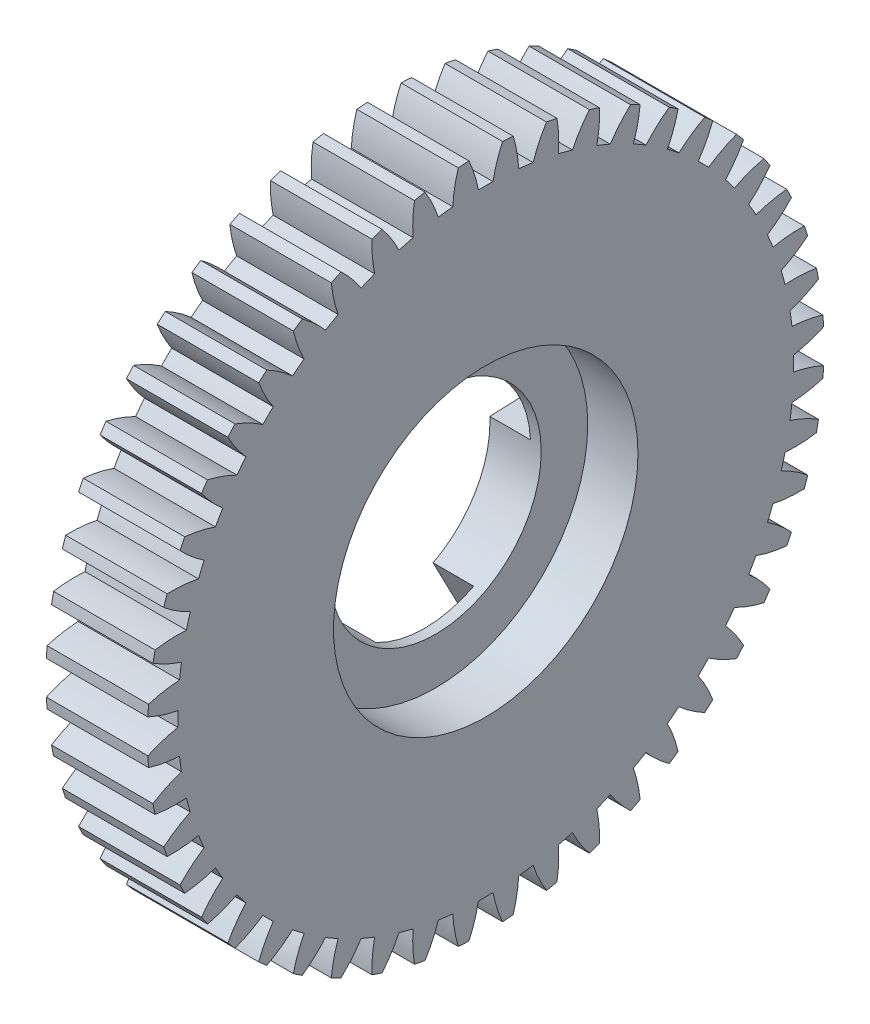
from build123d import *

# Parameters (mm, degrees)
SPUR_START             = -42.202133653
SPUR_GEAR_AI_OUTLINE_R = 9.525
SPUR_GEAR_AI_DEPTH     = 9.525
SKETCH1_R              = 9.921875
CUT_EXTRUDE1_DEPTH     = 64.52518683
SKETCH2_R              = 14.2875
CUT_EXTRUDE2_DEPTH     = 4.71424
CUT_EXTRUDE3_START     = -3.81
SKETCH3_R              = 26.9875
CUT_EXTRUDE3_DEPTH     = 3.81
FILLET3_R              = 3.175


# Read off the part's stored shape, not the designer's step: spur gear_ai
with BuildPart() as part:
    # spur gear_ai outline → spur gear_ai (new body)
    with BuildSketch(Plane.YZ.offset(SPUR_START)):
        with BuildLine():
            ThreePointArc((39.801048248, 9.63014284), (39.902920448, 10.121928447), (39.997001011, 10.615263906))
            ThreePointArc((39.997001011, 10.615263906), (38.698236885, 11.321633429), (37.323523356, 11.865608495))
            ThreePointArc((37.323523356, 11.865608495), (37.420899802, 12.54316048), (37.502204736, 13.222828319))
            ThreePointArc((37.502204736, 13.222828319), (38.970867144, 13.392465841), (40.408198841, 13.738621515))
            ThreePointArc((40.408198841, 13.738621515), (40.445008608, 14.239496818), (40.4738911, 14.740891702))
            ThreePointArc((40.4738911, 14.740891702), (39.094038357, 15.271695399), (37.660082699, 15.631580561))
            ThreePointArc((37.660082699, 15.631580561), (37.668187795, 16.316046171), (37.660082699, 17.000511781))
            ThreePointArc((37.660082699, 17.000511781), (39.094038357, 17.360396942), (40.4738911, 17.89120064))
            ThreePointArc((40.4738911, 17.89120064), (40.445008608, 18.392595524), (40.408198841, 18.893470827))
            ThreePointArc((40.408198841, 18.893470827), (38.970867144, 19.239626501), (37.502204736, 19.409264023))
            ThreePointArc((37.502204736, 19.409264023), (37.420899802, 20.088931862), (37.323523356, 20.766483847))
            ThreePointArc((37.323523356, 20.766483847), (38.698236885, 21.310458913), (39.997001011, 22.016828435))
            ThreePointArc((39.997001011, 22.016828435), (39.902920448, 22.510163894), (39.801048248, 23.001949501))
            ThreePointArc((39.801048248, 23.001949501), (38.330830741, 23.157534332), (36.852590803, 23.13402167))
            ThreePointArc((36.852590803, 23.13402167), (36.683266989, 23.797262433), (36.498285332, 24.45630769))
            ThreePointArc((36.498285332, 24.45630769), (37.790235002, 25.175065096), (38.985688297, 26.044914266))
            ThreePointArc((38.985688297, 26.044914266), (38.828019407, 26.521749194), (38.662827835, 26.996030516))
            ThreePointArc((38.662827835, 26.996030516), (37.184880347, 26.958382404), (35.722355975, 26.742121866))
            ThreePointArc((35.722355975, 26.742121866), (35.467910459, 27.37758732), (35.198488677, 28.006849402))
            ThreePointArc((35.198488677, 28.006849402), (36.385568871, 28.88809101), (37.457256797, 29.906536465))
            ThreePointArc((37.457256797, 29.906536465), (37.238697339, 30.358712085), (37.013012869, 30.807374038))
            ThreePointArc((37.013012869, 30.807374038), (35.552623491, 30.577137153), (34.130838883, 30.171829016))
            ThreePointArc((34.130838883, 30.171829016), (33.795625297, 30.768646171), (33.446373272, 31.357358229))
            ThreePointArc((33.446373272, 31.357358229), (34.508272719, 32.38600575), (35.4378584, 33.535621608))
            ThreePointArc((35.4378584, 33.535621608), (35.162147986, 33.955401069), (34.879832141, 34.370766922))
            ThreePointArc((34.879832141, 34.370766922), (33.461988541, 33.951880681), (32.105270825, 33.364459881))
            ThreePointArc((32.105270825, 33.364459881), (31.695024767, 33.912417029), (31.271918299, 34.450506037))
            ThreePointArc((31.271918299, 34.450506037), (32.190467605, 35.608959027), (32.96204557, 36.870075041))
            ThreePointArc((32.96204557, 36.870075041), (32.633901683, 37.2502758), (32.299784966, 37.625238529))
            ThreePointArc((32.299784966, 37.625238529), (30.94874684, 37.024870191), (29.680309833, 36.265387659))
            ThreePointArc((29.680309833, 36.265387659), (29.202050727, 36.755109102), (28.712329284, 37.233368208))
            ThreePointArc((28.712329284, 37.233368208), (29.471811815, 38.501805216), (30.072180153, 39.852843342))
            ThreePointArc((30.072180153, 39.852843342), (29.697217425, 40.186960058), (29.317016666, 40.515103946))
            ThreePointArc((29.317016666, 40.515103946), (28.055900652, 39.74352598), (26.897447661, 38.824976674))
            ThreePointArc((26.897447661, 38.824976674), (26.359358653, 39.248083143), (25.811401505, 39.6583292))
            ThreePointArc((25.811401505, 39.6583292), (26.398822306, 41.015046916), (26.817708547, 42.432890517))
            ThreePointArc((26.817708547, 42.432890517), (26.402342694, 42.715206362), (25.982563233, 42.990916775))
            ThreePointArc((25.982563233, 42.990916775), (24.832947375, 42.061331095), (23.804299854, 40.999431648))
            ThreePointArc((23.804299854, 40.999431648), (23.215587795, 41.348683672), (22.618770641, 41.683897258))
            ThreePointArc((22.618770641, 41.683897258), (23.024078778, 43.105681866), (23.254315663, 44.566071244))
            ThreePointArc((23.254315663, 44.566071244), (22.80565371, 44.791755715), (22.35347809, 45.010315173))
            ThreePointArc((22.35347809, 45.010315173), (21.335032634, 43.938627246), (20.453791026, 42.751547052))
            ThreePointArc((20.453791026, 42.751547052), (19.824528945, 43.020968834), (19.189063491, 43.27541435))
            ThreePointArc((19.189063491, 43.27541435), (19.405324029, 44.737938722), (19.442972141, 46.21588621))
            ThreePointArc((19.442972141, 46.21588621), (18.968690819, 46.381077782), (18.49185589, 46.538746672))
            ThreePointArc((18.49185589, 46.538746672), (17.622006721, 45.343293377), (16.903249315, 44.051343707))
            ThreePointArc((16.903249315, 44.051343707), (16.244204058, 44.236325365), (15.580963295, 44.405649179))
            ThreePointArc((15.580963295, 44.405649179), (15.604475957, 45.883889116), (15.448891126, 47.354106623))
            ThreePointArc((15.448891126, 47.354106623), (14.95710552, 47.455978824), (14.46377006, 47.550059387))
            ThreePointArc((14.46377006, 47.550059387), (13.757400537, 46.251295261), (13.213425471, 44.876581732))
            ThreePointArc((13.213425471, 44.876581732), (12.535873486, 44.973958178), (11.856205647, 45.055263112))
            ThreePointArc((11.856205647, 45.055263112), (11.686568125, 46.52392552), (11.340412451, 47.961257217))
            ThreePointArc((11.340412451, 47.961257217), (10.839537148, 47.998066984), (10.338142264, 48.026949476))
            ThreePointArc((10.338142264, 48.026949476), (9.807338567, 46.647096733), (9.447453406, 45.213141075))
            ThreePointArc((9.447453406, 45.213141075), (8.762987795, 45.221246171), (8.078522185, 45.213141075))
            ThreePointArc((8.078522185, 45.213141075), (7.718637024, 46.647096733), (7.187833326, 48.026949476))
            ThreePointArc((7.187833326, 48.026949476), (6.686438442, 47.998066984), (6.185563139, 47.961257217))
            ThreePointArc((6.185563139, 47.961257217), (5.839407465, 46.52392552), (5.669769943, 45.055263112))
            ThreePointArc((5.669769943, 45.055263112), (4.990102104, 44.973958178), (4.312550119, 44.876581732))
            ThreePointArc((4.312550119, 44.876581732), (3.768575054, 46.251295261), (3.062205531, 47.550059387))
            ThreePointArc((3.062205531, 47.550059387), (2.568870071, 47.455978824), (2.077084465, 47.354106623))
            ThreePointArc((2.077084465, 47.354106623), (1.921499634, 45.883889116), (1.945012296, 44.405649179))
            ThreePointArc((1.945012296, 44.405649179), (1.281771533, 44.236325365), (0.622726276, 44.051343707))
            ThreePointArc((0.622726276, 44.051343707), (-0.09603113, 45.343293377), (-0.965880299, 46.538746672))
            ThreePointArc((-0.965880299, 46.538746672), (-1.442715228, 46.381077782), (-1.91699655, 46.21588621))
            ThreePointArc((-1.91699655, 46.21588621), (-1.879348438, 44.737938722), (-1.6630879, 43.27541435))
            ThreePointArc((-1.6630879, 43.27541435), (-2.298553354, 43.020968834), (-2.927815436, 42.751547052))
            ThreePointArc((-2.927815436, 42.751547052), (-3.809057043, 43.938627246), (-4.827502499, 45.010315173))
            ThreePointArc((-4.827502499, 45.010315173), (-5.279678119, 44.791755715), (-5.728340072, 44.566071244))
            ThreePointArc((-5.728340072, 44.566071244), (-5.498103187, 43.105681866), (-5.09279505, 41.683897258))
            ThreePointArc((-5.09279505, 41.683897258), (-5.689612205, 41.348683672), (-6.278324263, 40.999431648))
            ThreePointArc((-6.278324263, 40.999431648), (-7.306971784, 42.061331095), (-8.456587642, 42.990916775))
            ThreePointArc((-8.456587642, 42.990916775), (-8.876367103, 42.715206362), (-9.291732956, 42.432890517))
            ThreePointArc((-9.291732956, 42.432890517), (-8.872846715, 41.015046916), (-8.285425914, 39.6583292))
            ThreePointArc((-8.285425914, 39.6583292), (-8.833383062, 39.248083143), (-9.37147207, 38.824976674))
            ThreePointArc((-9.37147207, 38.824976674), (-10.529925061, 39.74352598), (-11.791041075, 40.515103946))
            ThreePointArc((-11.791041075, 40.515103946), (-12.171241834, 40.186960058), (-12.546204562, 39.852843342))
            ThreePointArc((-12.546204562, 39.852843342), (-11.945836225, 38.501805216), (-11.186353693, 37.233368208))
            ThreePointArc((-11.186353693, 37.233368208), (-11.676075136, 36.755109102), (-12.154334242, 36.265387659))
            ThreePointArc((-12.154334242, 36.265387659), (-13.42277125, 37.024870191), (-14.773809375, 37.625238529))
            ThreePointArc((-14.773809375, 37.625238529), (-15.107926092, 37.2502758), (-15.43606998, 36.870075041))
            ThreePointArc((-15.43606998, 36.870075041), (-14.664492014, 35.608959027), (-13.745942708, 34.450506037))
            ThreePointArc((-13.745942708, 34.450506037), (-14.169049176, 33.912417029), (-14.579295234, 33.364459881))
            ThreePointArc((-14.579295234, 33.364459881), (-15.93601295, 33.951880681), (-17.353856551, 34.370766922))
            ThreePointArc((-17.353856551, 34.370766922), (-17.636172395, 33.955401069), (-17.911882809, 33.535621608))
            ThreePointArc((-17.911882809, 33.535621608), (-16.982297129, 32.38600575), (-15.920397682, 31.357358229))
            ThreePointArc((-15.920397682, 31.357358229), (-16.269649706, 30.768646171), (-16.604863292, 30.171829016))
            ThreePointArc((-16.604863292, 30.171829016), (-18.0266479, 30.577137153), (-19.487037278, 30.807374038))
            ThreePointArc((-19.487037278, 30.807374038), (-19.712721748, 30.358712085), (-19.931281207, 29.906536465))
            ThreePointArc((-19.931281207, 29.906536465), (-18.85959328, 28.88809101), (-17.672513086, 28.006849402))
            ThreePointArc((-17.672513086, 28.006849402), (-17.941934868, 27.37758732), (-18.196380384, 26.742121866))
            ThreePointArc((-18.196380384, 26.742121866), (-19.658904756, 26.958382404), (-21.136852244, 26.996030516))
            ThreePointArc((-21.136852244, 26.996030516), (-21.302043816, 26.521749194), (-21.459712706, 26.044914266))
            ThreePointArc((-21.459712706, 26.044914266), (-20.264259411, 25.175065096), (-18.972309741, 24.45630769))
            ThreePointArc((-18.972309741, 24.45630769), (-19.157291399, 23.797262433), (-19.326615212, 23.13402167))
            ThreePointArc((-19.326615212, 23.13402167), (-20.80485515, 23.157534332), (-22.275072657, 23.001949501))
            ThreePointArc((-22.275072657, 23.001949501), (-22.376944857, 22.510163894), (-22.471025421, 22.016828435))
            ThreePointArc((-22.471025421, 22.016828435), (-21.172261294, 21.310458913), (-19.797547766, 20.766483847))
            ThreePointArc((-19.797547766, 20.766483847), (-19.894924212, 20.088931862), (-19.976229145, 19.409264023))
            ThreePointArc((-19.976229145, 19.409264023), (-21.444891554, 19.239626501), (-22.882223251, 18.893470827))
            ThreePointArc((-22.882223251, 18.893470827), (-22.919033017, 18.392595524), (-22.947915509, 17.89120064))
            ThreePointArc((-22.947915509, 17.89120064), (-21.568062766, 17.360396942), (-20.134107108, 17.000511781))
            ThreePointArc((-20.134107108, 17.000511781), (-20.142212205, 16.316046171), (-20.134107108, 15.631580561))
            ThreePointArc((-20.134107108, 15.631580561), (-21.568062766, 15.271695399), (-22.947915509, 14.740891702))
            ThreePointArc((-22.947915509, 14.740891702), (-22.919033017, 14.239496818), (-22.882223251, 13.738621515))
            ThreePointArc((-22.882223251, 13.738621515), (-21.444891554, 13.392465841), (-19.976229145, 13.222828319))
            ThreePointArc((-19.976229145, 13.222828319), (-19.894924212, 12.54316048), (-19.797547766, 11.865608495))
            ThreePointArc((-19.797547766, 11.865608495), (-21.172261295, 11.321633429), (-22.471025421, 10.615263906))
            ThreePointArc((-22.471025421, 10.615263906), (-22.376944857, 10.121928447), (-22.275072657, 9.63014284))
            ThreePointArc((-22.275072657, 9.63014284), (-20.80485515, 9.47455801), (-19.326615212, 9.498070672))
            ThreePointArc((-19.326615212, 9.498070672), (-19.157291399, 8.834829909), (-18.972309741, 8.175784652))
            ThreePointArc((-18.972309741, 8.175784652), (-20.264259411, 7.457027246), (-21.459712706, 6.587178076))
            ThreePointArc((-21.459712706, 6.587178076), (-21.302043816, 6.110343147), (-21.136852244, 5.636061825))
            ThreePointArc((-21.136852244, 5.636061825), (-19.658904756, 5.673709937), (-18.196380384, 5.889970476))
            ThreePointArc((-18.196380384, 5.889970476), (-17.941934868, 5.254505022), (-17.672513086, 4.62524294))
            ThreePointArc((-17.672513086, 4.62524294), (-18.85959328, 3.744001332), (-19.931281207, 2.725555876))
            ThreePointArc((-19.931281207, 2.725555876), (-19.712721748, 2.273380257), (-19.487037278, 1.824718304))
            ThreePointArc((-19.487037278, 1.824718304), (-18.0266479, 2.054955189), (-16.604863292, 2.460263325))
            ThreePointArc((-16.604863292, 2.460263325), (-16.269649706, 1.863446171), (-15.920397682, 1.274734113))
            ThreePointArc((-15.920397682, 1.274734113), (-16.982297129, 0.246086592), (-17.911882809, -0.903529267))
            ThreePointArc((-17.911882809, -0.903529267), (-17.636172395, -1.323308727), (-17.353856551, -1.738674581))
            ThreePointArc((-17.353856551, -1.738674581), (-15.936012951, -1.319788339), (-14.579295234, -0.732367539))
            ThreePointArc((-14.579295234, -0.732367539), (-14.169049176, -1.280324687), (-13.745942708, -1.818413695))
            ThreePointArc((-13.745942708, -1.818413695), (-14.664492014, -2.976866685), (-15.43606998, -4.2379827))
            ThreePointArc((-15.43606998, -4.2379827), (-15.107926092, -4.618183459), (-14.773809375, -4.993146187))
            ThreePointArc((-14.773809375, -4.993146187), (-13.42277125, -4.392777849), (-12.154334242, -3.633295318))
            ThreePointArc((-12.154334242, -3.633295318), (-11.676075136, -4.123016761), (-11.186353693, -4.601275866))
            ThreePointArc((-11.186353693, -4.601275866), (-11.945836225, -5.869712874), (-12.546204562, -7.220751))
            ThreePointArc((-12.546204562, -7.220751), (-12.171241834, -7.554867717), (-11.791041075, -7.883011604))
            ThreePointArc((-11.791041075, -7.883011604), (-10.529925061, -7.111433639), (-9.37147207, -6.192884333))
            ThreePointArc((-9.37147207, -6.192884333), (-8.833383062, -6.615990801), (-8.285425914, -7.026236859))
            ThreePointArc((-8.285425914, -7.026236859), (-8.872846715, -8.382954575), (-9.291732956, -9.800798175))
            ThreePointArc((-9.291732956, -9.800798175), (-8.876367103, -10.08311402), (-8.456587642, -10.358824433))
            ThreePointArc((-8.456587642, -10.358824433), (-7.306971784, -9.429238753), (-6.278324263, -8.367339306))
            ThreePointArc((-6.278324263, -8.367339306), (-5.689612205, -8.716591331), (-5.09279505, -9.051804916))
            ThreePointArc((-5.09279505, -9.051804916), (-5.498103187, -10.473589524), (-5.728340072, -11.933978902))
            ThreePointArc((-5.728340072, -11.933978902), (-5.279678119, -12.159663373), (-4.827502499, -12.378222831))
            ThreePointArc((-4.827502499, -12.378222831), (-3.809057043, -11.306534905), (-2.927815436, -10.119454711))
            ThreePointArc((-2.927815436, -10.119454711), (-2.298553354, -10.388876492), (-1.6630879, -10.643322009))
            ThreePointArc((-1.6630879, -10.643322009), (-1.879348438, -12.10584638), (-1.91699655, -13.583793868))
            ThreePointArc((-1.91699655, -13.583793868), (-1.442715228, -13.748985441), (-0.965880299, -13.90665433))
            ThreePointArc((-0.965880299, -13.90665433), (-0.09603113, -12.711201035), (0.622726276, -11.419251366))
            ThreePointArc((0.622726276, -11.419251366), (1.281771533, -11.604233023), (1.945012296, -11.773556837))
            ThreePointArc((1.945012296, -11.773556837), (1.921499634, -13.251796775), (2.077084465, -14.722014282))
            ThreePointArc((2.077084465, -14.722014282), (2.568870072, -14.823886482), (3.062205531, -14.917967045))
            ThreePointArc((3.062205531, -14.917967045), (3.768575054, -13.619202919), (4.312550119, -12.24448939))
            ThreePointArc((4.312550119, -12.24448939), (4.990102104, -12.341865836), (5.669769943, -12.42317077))
            ThreePointArc((5.669769943, -12.42317077), (5.839407465, -13.891833178), (6.185563139, -15.329164875))
            ThreePointArc((6.185563139, -15.329164875), (6.686438442, -15.365974642), (7.187833326, -15.394857134))
            ThreePointArc((7.187833326, -15.394857134), (7.718637024, -14.015004391), (8.078522185, -12.581048733))
            ThreePointArc((8.078522185, -12.581048733), (8.762987795, -12.589153829), (9.447453406, -12.581048733))
            ThreePointArc((9.447453406, -12.581048733), (9.807338567, -14.015004391), (10.338142264, -15.394857134))
            ThreePointArc((10.338142264, -15.394857134), (10.839537148, -15.365974642), (11.340412451, -15.329164875))
            ThreePointArc((11.340412451, -15.329164875), (11.686568125, -13.891833178), (11.856205647, -12.42317077))
            ThreePointArc((11.856205647, -12.42317077), (12.535873486, -12.341865836), (13.213425471, -12.24448939))
            ThreePointArc((13.213425471, -12.24448939), (13.757400537, -13.619202919), (14.46377006, -14.917967045))
            ThreePointArc((14.46377006, -14.917967045), (14.957105519, -14.823886482), (15.448891126, -14.722014282))
            ThreePointArc((15.448891126, -14.722014282), (15.604475957, -13.251796775), (15.580963295, -11.773556837))
            ThreePointArc((15.580963295, -11.773556837), (16.244204058, -11.604233023), (16.903249315, -11.419251366))
            ThreePointArc((16.903249315, -11.419251366), (17.622006721, -12.711201035), (18.49185589, -13.90665433))
            ThreePointArc((18.49185589, -13.90665433), (18.968690819, -13.748985441), (19.442972141, -13.583793868))
            ThreePointArc((19.442972141, -13.583793868), (19.405324029, -12.10584638), (19.189063491, -10.643322009))
            ThreePointArc((19.189063491, -10.643322009), (19.824528944, -10.388876492), (20.453791026, -10.119454711))
            ThreePointArc((20.453791026, -10.119454711), (21.335032634, -11.306534905), (22.35347809, -12.378222831))
            ThreePointArc((22.35347809, -12.378222831), (22.80565371, -12.159663373), (23.254315663, -11.933978902))
            ThreePointArc((23.254315663, -11.933978902), (23.024078778, -10.473589524), (22.618770641, -9.051804916))
            ThreePointArc((22.618770641, -9.051804916), (23.215587796, -8.716591331), (23.804299854, -8.367339306))
            ThreePointArc((23.804299854, -8.367339306), (24.832947375, -9.429238753), (25.982563233, -10.358824433))
            ThreePointArc((25.982563233, -10.358824433), (26.402342694, -10.08311402), (26.817708547, -9.800798175))
            ThreePointArc((26.817708547, -9.800798175), (26.398822306, -8.382954575), (25.811401505, -7.026236859))
            ThreePointArc((25.811401505, -7.026236859), (26.359358653, -6.615990801), (26.897447661, -6.192884333))
            ThreePointArc((26.897447661, -6.192884333), (28.055900652, -7.111433639), (29.317016666, -7.883011604))
            ThreePointArc((29.317016666, -7.883011604), (29.697217425, -7.554867717), (30.072180153, -7.220751))
            ThreePointArc((30.072180153, -7.220751), (29.471811815, -5.869712874), (28.712329284, -4.601275866))
            ThreePointArc((28.712329284, -4.601275866), (29.202050727, -4.123016761), (29.680309833, -3.633295318))
            ThreePointArc((29.680309833, -3.633295318), (30.948746841, -4.392777849), (32.299784966, -4.993146187))
            ThreePointArc((32.299784966, -4.993146187), (32.633901683, -4.618183459), (32.96204557, -4.2379827))
            ThreePointArc((32.96204557, -4.2379827), (32.190467605, -2.976866685), (31.271918299, -1.818413695))
            ThreePointArc((31.271918299, -1.818413695), (31.695024767, -1.280324687), (32.105270825, -0.732367539))
            ThreePointArc((32.105270825, -0.732367539), (33.461988541, -1.319788339), (34.879832141, -1.738674581))
            ThreePointArc((34.879832141, -1.738674581), (35.162147986, -1.323308728), (35.4378584, -0.903529267))
            ThreePointArc((35.4378584, -0.903529267), (34.508272719, 0.246086592), (33.446373272, 1.274734113))
            ThreePointArc((33.446373272, 1.274734113), (33.795625297, 1.863446171), (34.130838883, 2.460263325))
            ThreePointArc((34.130838883, 2.460263325), (35.552623491, 2.054955189), (37.013012869, 1.824718304))
            ThreePointArc((37.013012869, 1.824718304), (37.238697339, 2.273380256), (37.457256797, 2.725555876))
            ThreePointArc((37.457256797, 2.725555876), (36.385568871, 3.744001332), (35.198488677, 4.62524294))
            ThreePointArc((35.198488677, 4.62524294), (35.467910459, 5.254505022), (35.722355975, 5.889970476))
            ThreePointArc((35.722355975, 5.889970476), (37.184880347, 5.673709937), (38.662827835, 5.636061825))
            ThreePointArc((38.662827835, 5.636061825), (38.828019407, 6.110343147), (38.985688297, 6.587178076))
            ThreePointArc((38.985688297, 6.587178076), (37.790235002, 7.457027246), (36.498285332, 8.175784652))
            ThreePointArc((36.498285332, 8.175784652), (36.683266989, 8.834829909), (36.852590803, 9.498070672))
            ThreePointArc((36.852590803, 9.498070672), (38.330830741, 9.47455801), (39.801048248, 9.63014284))
        make_face()
        with Locations((8.762987795, 16.316046171)):
            Circle(SPUR_GEAR_AI_OUTLINE_R, mode=Mode.SUBTRACT)
    extrude(amount=SPUR_GEAR_AI_DEPTH)

    # Sketch1 → Cut-Extrude1 (cut, through all)
    with BuildSketch(Plane(origin=(-32.677133653, 0, 0), x_dir=(0, 0, -1), z_dir=(1, 0, 0))):
        with Locations((-16.316046171, 8.762987795)):
            Circle(SKETCH1_R)
    extrude(amount=-CUT_EXTRUDE1_DEPTH, mode=Mode.SUBTRACT)

    # Sketch2 → Cut-Extrude2 (cut)
    with BuildSketch(Plane(origin=(-32.677133653, 0, 0), x_dir=(0, 0, -1), z_dir=(1, 0, 0))):
        with Locations((-16.316046171, 8.762987795)):
            Circle(SKETCH2_R)
    extrude(amount=-CUT_EXTRUDE2_DEPTH, mode=Mode.SUBTRACT)

    # Sketch3 → Cut-Extrude3 (cut)
    with BuildSketch(Plane.ZY.offset(42.202133653).offset(CUT_EXTRUDE3_START)):
        with Locations((16.316046171, 8.762987795)):
            Circle(SKETCH3_R)
        with BuildLine():
            Line((-1.494647873, 9.541664256), (6.403639953, 9.196354253))
            ThreePointArc((6.403639953, 9.196354253), (7.723740834, 13.724428363), (10.985516556, 17.131324401))
            Line((10.985516556, 17.131324401), (6.738106167, 23.799284701))
            ThreePointArc((6.738106167, 23.799284701), (6.388797365, 26.462565193), (8.206151798, 28.440519308))
            ThreePointArc((8.206151798, 28.440519308), (16.317292253, 30.046211978), (24.428244633, 28.439569542))
            ThreePointArc((24.428244633, 28.439569542), (26.245367446, 26.461402638), (25.895746789, 23.798163066))
            Line((25.895746789, 23.798163066), (21.647555641, 17.130700164))
            ThreePointArc((21.647555641, 17.130700164), (24.90893241, 13.723422211), (26.228503066, 9.195193554))
            Line((26.228503066, 9.195193554), (34.126831272, 9.539578702))
            ThreePointArc((34.126831272, 9.539578702), (36.607954236, 8.510448752), (37.41223553, 5.947596588))
            ThreePointArc((37.41223553, 5.947596588), (34.747235946, -1.879703435), (29.300366592, -8.100673027))
            ThreePointArc((29.300366592, -8.100673027), (26.678662394, -8.685264092), (24.547039597, -7.050863936))
            Line((24.547039597, -7.050863936), (20.896942918, -0.038091031))
            ThreePointArc((20.896942918, -0.038091031), (16.315465269, -1.158887188), (11.73411889, -0.037554569))
            Line((11.73411889, -0.037554569), (8.083201074, -7.049900017))
            ThreePointArc((8.083201074, -7.049900017), (5.951386911, -8.684050559), (3.329751184, -8.099152509))
            ThreePointArc((3.329751184, -8.099152509), (-2.116389687, -1.877545157), (-4.780472713, 5.950066871))
            ThreePointArc((-4.780472713, 5.950066871), (-3.975891327, 8.51282484), (-1.494647873, 9.541664256))
        make_face(mode=Mode.SUBTRACT)
    extrude(amount=CUT_EXTRUDE3_DEPTH, mode=Mode.SUBTRACT)

    # Fillet3
    fillet3_edges = [part.edges().sort_by_distance(p)[0] for p in [
        (-38.392133653, 8.762987795, -10.671453829),
    ]]
    fillet(fillet3_edges, radius=FILLET3_R)


solid = part.part
